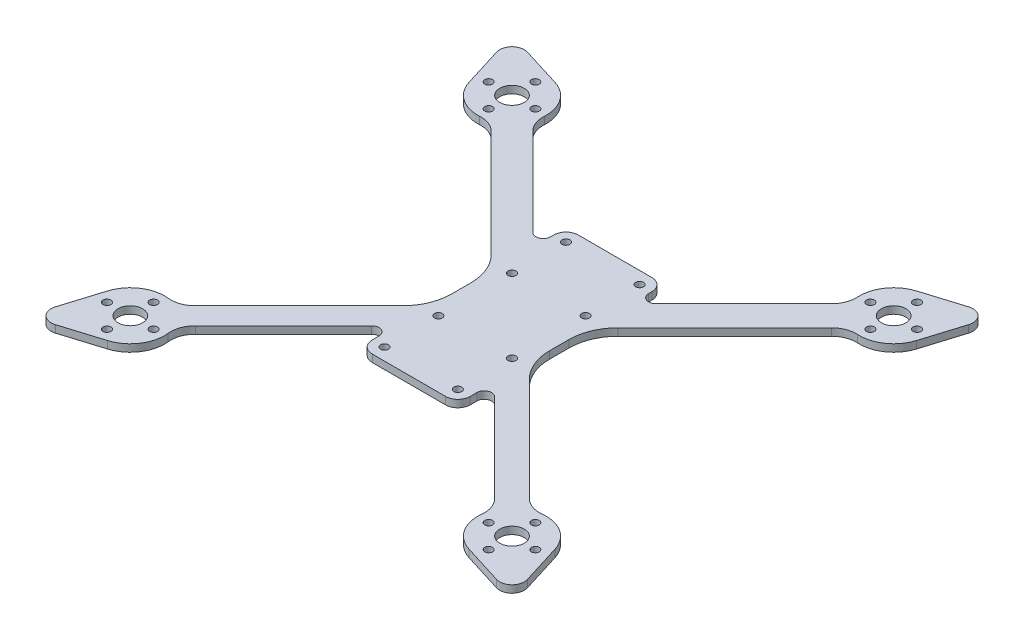
from build123d import *

# Parameters (mm, degrees)
SKETCH1_R           = 1.6
SKETCH1_R_2         = 5
BOSS_EXTRUDE1_DEPTH = 3


with BuildPart() as part:
    # Sketch1 → Boss-Extrude1 (new body)
    with BuildSketch(Plane(origin=(0, 0, 0), x_dir=(1, 0, 0), z_dir=(0, 1, 0))):
        with BuildLine():
            Line((-15, 42), (15, 42))
            ThreePointArc((15, 42), (18.535533906, 40.535533906), (20, 37))
            Line((20, 37), (20, 35.727922061))
            ThreePointArc((20, 35.727922061), (21.851949703, 32.956283464), (25.121320344, 33.606601718))
            Line((25.121320344, 33.606601718), (60.889994603, 69.375275977))
            ThreePointArc((60.889994603, 69.375275977), (63.16065038, 72.878122891), (63.803434766, 77.002761348))
            ThreePointArc((63.803434766, 77.002761348), (66.287641348, 85.774590221), (73.646067483, 91.156952986))
            Line((73.646067483, 91.156952986), (89.941777265, 96.195664945))
            ThreePointArc((89.941777265, 96.195664945), (94.954339188, 94.954339188), (96.195664945, 89.941777265))
            Line((96.195664945, 89.941777265), (91.156952986, 73.646067483))
            ThreePointArc((91.156952986, 73.646067483), (85.774590221, 66.287641348), (77.002761348, 63.803434766))
            ThreePointArc((77.002761348, 63.803434766), (72.878122891, 63.16065038), (69.375275977, 60.889994603))
            Line((69.375275977, 60.889994603), (25.857864376, 17.372583002))
            ThreePointArc((25.857864376, 17.372583002), (21.52240935, 10.884116026), (20, 3.230447378))
            Line((20, 3.230447378), (20, -4.644660941))
            ThreePointArc((20, -4.644660941), (21.52240935, -12.298329588), (25.857864376, -18.786796564))
            Line((25.857864376, -18.786796564), (68.069638537, -60.998570725))
            ThreePointArc((68.069638537, -60.998570725), (71.828794135, -63.363139484), (76.241139508, -63.866770837))
            ThreePointArc((76.241139508, -63.866770837), (85.457884527, -66.073761636), (91.156952986, -73.646067483))
            Line((91.156952986, -73.646067483), (96.195664945, -89.941777265))
            ThreePointArc((96.195664945, -89.941777265), (94.954339188, -94.954339188), (89.941777265, -96.195664945))
            Line((89.941777265, -96.195664945), (73.646067483, -91.156952986))
            ThreePointArc((73.646067483, -91.156952986), (66.073761636, -85.457884527), (63.866770837, -76.241139508))
            ThreePointArc((63.866770837, -76.241139508), (63.363139484, -71.828794135), (60.998570725, -68.069638537))
            Line((60.998570725, -68.069638537), (25.065407313, -32.136475125))
            ThreePointArc((25.065407313, -32.136475125), (21.796036672, -31.486156871), (19.944086969, -34.257795468))
            Line((19.944086969, -34.257795468), (19.944086969, -37))
            ThreePointArc((19.944086969, -37), (18.479620875, -40.535533906), (14.944086969, -42))
            Line((14.944086969, -42), (-14.944086969, -42))
            ThreePointArc((-14.944086969, -42), (-18.479620875, -40.535533906), (-19.944086969, -37))
            Line((-19.944086969, -37), (-19.944086969, -34.257795468))
            ThreePointArc((-19.944086969, -34.257795468), (-21.796036672, -31.486156871), (-25.065407313, -32.136475125))
            Line((-25.065407313, -32.136475125), (-60.998570725, -68.069638537))
            ThreePointArc((-60.998570725, -68.069638537), (-63.363139484, -71.828794135), (-63.866770837, -76.241139508))
            ThreePointArc((-63.866770837, -76.241139508), (-66.073761636, -85.457884527), (-73.646067483, -91.156952986))
            Line((-73.646067483, -91.156952986), (-89.941777265, -96.195664945))
            ThreePointArc((-89.941777265, -96.195664945), (-94.954339188, -94.954339188), (-96.195664945, -89.941777265))
            Line((-96.195664945, -89.941777265), (-91.156952986, -73.646067483))
            ThreePointArc((-91.156952986, -73.646067483), (-85.457884527, -66.073761636), (-76.241139508, -63.866770837))
            ThreePointArc((-76.241139508, -63.866770837), (-71.828794135, -63.363139484), (-68.069638537, -60.998570725))
            Line((-68.069638537, -60.998570725), (-25.857864376, -18.786796564))
            ThreePointArc((-25.857864376, -18.786796564), (-21.52240935, -12.298329588), (-20, -4.644660941))
            Line((-20, -4.644660941), (-20, 3.230447378))
            ThreePointArc((-20, 3.230447378), (-21.52240935, 10.884116026), (-25.857864376, 17.372583002))
            Line((-25.857864376, 17.372583002), (-69.375275977, 60.889994603))
            ThreePointArc((-69.375275977, 60.889994603), (-72.878122891, 63.16065038), (-77.002761348, 63.803434766))
            ThreePointArc((-77.002761348, 63.803434766), (-85.774590221, 66.287641348), (-91.156952986, 73.646067483))
            Line((-91.156952986, 73.646067483), (-96.195664945, 89.941777265))
            ThreePointArc((-96.195664945, 89.941777265), (-94.954339188, 94.954339188), (-89.941777265, 96.195664945))
            Line((-89.941777265, 96.195664945), (-73.646067483, 91.156952986))
            ThreePointArc((-73.646067483, 91.156952986), (-66.287641348, 85.774590221), (-63.803434766, 77.002761348))
            ThreePointArc((-63.803434766, 77.002761348), (-63.16065038, 72.878122891), (-60.889994603, 69.375275977))
            Line((-60.889994603, 69.375275977), (-25.121320344, 33.606601718))
            ThreePointArc((-25.121320344, 33.606601718), (-21.851949703, 32.956283464), (-20, 35.727922061))
            Line((-20, 35.727922061), (-20, 37))
            ThreePointArc((-20, 37), (-18.535533906, 40.535533906), (-15, 42))
        make_face()
        with Locations((77.781745931, 68.281745931)):
            Circle(SKETCH1_R, mode=Mode.SUBTRACT)
        with Locations((68.281745931, 77.781745931)):
            Circle(SKETCH1_R, mode=Mode.SUBTRACT)
        with Locations((77.781745931, 87.281745931)):
            Circle(SKETCH1_R, mode=Mode.SUBTRACT)
        with Locations((87.281745931, 77.781745931)):
            Circle(SKETCH1_R, mode=Mode.SUBTRACT)
        with Locations((77.781745931, -87.281745931)):
            Circle(SKETCH1_R, mode=Mode.SUBTRACT)
        with Locations((68.281745931, -77.781745931)):
            Circle(SKETCH1_R, mode=Mode.SUBTRACT)
        with Locations((77.781745931, -68.281745931)):
            Circle(SKETCH1_R, mode=Mode.SUBTRACT)
        with Locations((87.281745931, -77.781745931)):
            Circle(SKETCH1_R, mode=Mode.SUBTRACT)
        with Locations((15, 15)):
            Circle(SKETCH1_R, mode=Mode.SUBTRACT)
        with Locations((15, -15)):
            Circle(SKETCH1_R, mode=Mode.SUBTRACT)
        with Locations((77.781745931, 77.781745931)):
            Circle(SKETCH1_R_2, mode=Mode.SUBTRACT)
        with Locations((77.781745931, -77.781745931)):
            Circle(SKETCH1_R_2, mode=Mode.SUBTRACT)
        with Locations((14.944086969, -37)):
            Circle(SKETCH1_R, mode=Mode.SUBTRACT)
        with Locations((15, 37)):
            Circle(SKETCH1_R, mode=Mode.SUBTRACT)
        with Locations((-15, 37)):
            Circle(SKETCH1_R, mode=Mode.SUBTRACT)
        with Locations((-14.944086969, -37)):
            Circle(SKETCH1_R, mode=Mode.SUBTRACT)
        with Locations((-77.781745931, -77.781745931)):
            Circle(SKETCH1_R_2, mode=Mode.SUBTRACT)
        with Locations((-77.781745931, 77.781745931)):
            Circle(SKETCH1_R_2, mode=Mode.SUBTRACT)
        with Locations((-15, -15)):
            Circle(SKETCH1_R, mode=Mode.SUBTRACT)
        with Locations((-15, 15)):
            Circle(SKETCH1_R, mode=Mode.SUBTRACT)
        with Locations((-87.281745931, -77.781745931)):
            Circle(SKETCH1_R, mode=Mode.SUBTRACT)
        with Locations((-77.781745931, -68.281745931)):
            Circle(SKETCH1_R, mode=Mode.SUBTRACT)
        with Locations((-68.281745931, -77.781745931)):
            Circle(SKETCH1_R, mode=Mode.SUBTRACT)
        with Locations((-77.781745931, -87.281745931)):
            Circle(SKETCH1_R, mode=Mode.SUBTRACT)
        with Locations((-87.281745931, 77.781745931)):
            Circle(SKETCH1_R, mode=Mode.SUBTRACT)
        with Locations((-77.781745931, 87.281745931)):
            Circle(SKETCH1_R, mode=Mode.SUBTRACT)
        with Locations((-68.281745931, 77.781745931)):
            Circle(SKETCH1_R, mode=Mode.SUBTRACT)
        with Locations((-77.781745931, 68.281745931)):
            Circle(SKETCH1_R, mode=Mode.SUBTRACT)
    extrude(amount=BOSS_EXTRUDE1_DEPTH)


solid = part.part
